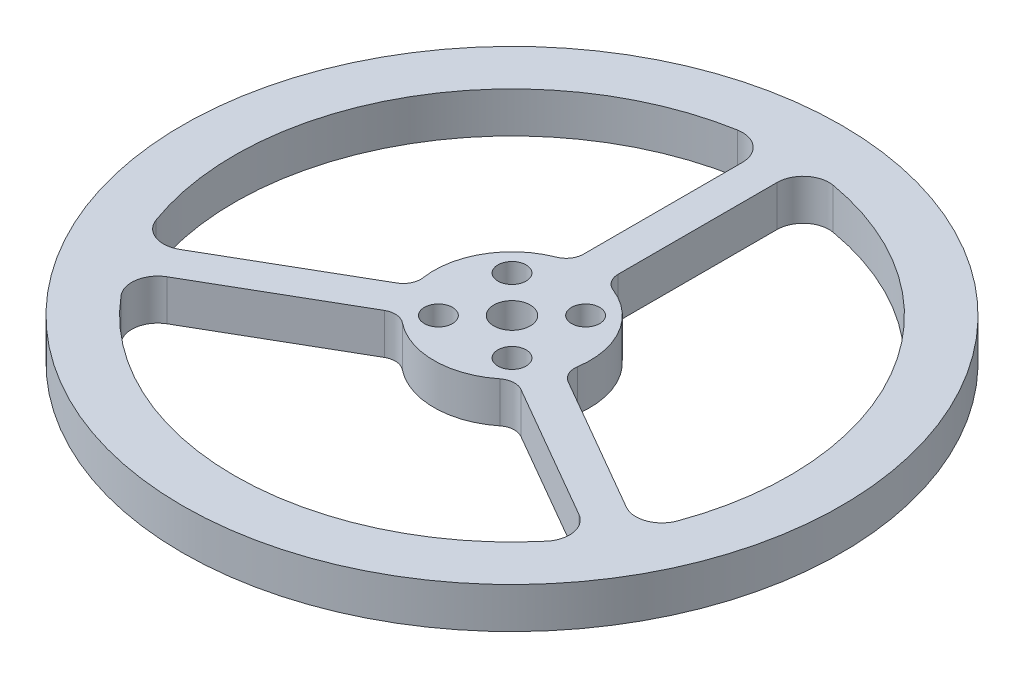
from build123d import *

# Parameters (mm, degrees)
SKETCH1_R           = 38
SKETCH1_R_2         = 2.1
SKETCH1_R_3         = 1.625
BOSS_EXTRUDE1_DEPTH = 4.7


with BuildPart() as part:
    # Sketch1 → Boss-Extrude1 (new body)
    with BuildSketch(Plane(origin=(0, 0, 0), x_dir=(1, 0, 0), z_dir=(0, 1, 0))):
        Circle(SKETCH1_R)
        Circle(SKETCH1_R_2, mode=Mode.SUBTRACT)
        with Locations((-4.242640687, 4.242640687)):
            Circle(SKETCH1_R_3, mode=Mode.SUBTRACT)
        with Locations((-4.242640687, -4.242640687)):
            Circle(SKETCH1_R_3, mode=Mode.SUBTRACT)
        with Locations((4.242640687, -4.242640687)):
            Circle(SKETCH1_R_3, mode=Mode.SUBTRACT)
        with Locations((4.242640687, 4.242640687)):
            Circle(SKETCH1_R_3, mode=Mode.SUBTRACT)
        with BuildLine():
            Line((2, 10.246950766), (2, 28.565713714))
            ThreePointArc((2, 28.565713714), (3.070197437, 30.862638195), (5.517241379, 31.520787547))
            ThreePointArc((5.517241379, 31.520787547), (27.712812921, 16), (30.056423452, -10.98232258))
            ThreePointArc((30.056423452, -10.98232258), (28.262927423, -12.772450122), (25.738633754, -12.55080605))
            Line((25.738633754, -12.55080605), (9.874119675, -3.391424575))
            ThreePointArc((9.874119675, -3.391424575), (9.07138843, -2.525491577), (8.897007007, -1.357669446))
            ThreePointArc((8.897007007, -1.357669446), (8.899020616, 1.344407704), (8.098889143, 3.925301854))
            ThreePointArc((8.098889143, 3.925301854), (6.107218663, 6.610739762), (3.272727273, 8.383868809))
            ThreePointArc((3.272727273, 8.383868809), (2.348554352, 9.118798616), (2, 10.246950766))
        make_face(mode=Mode.SUBTRACT)
        with BuildLine():
            Line((-2, 10.246950766), (-2, 28.565713714))
            ThreePointArc((-2, 28.565713714), (-3.070197437, 30.862638195), (-5.517241379, 31.520787547))
            ThreePointArc((-5.517241379, 31.520787547), (-27.712812921, 16), (-30.056423452, -10.98232258))
            ThreePointArc((-30.056423452, -10.98232258), (-28.262927423, -12.772450122), (-25.738633754, -12.55080605))
            Line((-25.738633754, -12.55080605), (-9.874119675, -3.391424575))
            ThreePointArc((-9.874119675, -3.391424575), (-9.07138843, -2.525491577), (-8.897007007, -1.357669446))
            ThreePointArc((-8.897007007, -1.357669446), (-7.794228634, 4.5), (-3.272727273, 8.383868809))
            ThreePointArc((-3.272727273, 8.383868809), (-2.348554352, 9.118798616), (-2, 10.246950766))
        make_face(mode=Mode.SUBTRACT)
        with BuildLine():
            Line((7.874119675, -6.855526191), (23.738633754, -16.014907665))
            ThreePointArc((23.738633754, -16.014907665), (25.192729986, -18.090188073), (24.539182073, -20.538464967))
            ThreePointArc((24.539182073, -20.538464967), (0, -32), (-24.539182073, -20.538464967))
            ThreePointArc((-24.539182073, -20.538464967), (-25.192729986, -18.090188073), (-23.738633754, -16.014907665))
            Line((-23.738633754, -16.014907665), (-7.874119675, -6.855526191))
            ThreePointArc((-7.874119675, -6.855526191), (-6.722834078, -6.593307039), (-5.624279734, -7.026199362))
            ThreePointArc((-5.624279734, -7.026199362), (0, -9), (5.624279734, -7.026199362))
            ThreePointArc((5.624279734, -7.026199362), (6.722834078, -6.593307039), (7.874119675, -6.855526191))
        make_face(mode=Mode.SUBTRACT)
    extrude(amount=BOSS_EXTRUDE1_DEPTH)


solid = part.part
